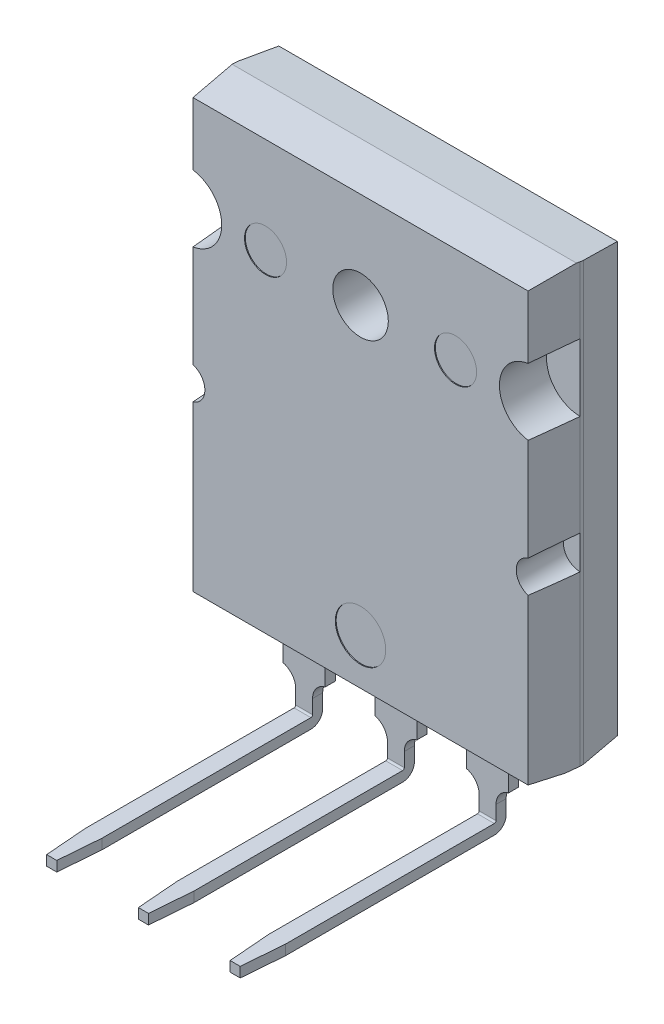
from build123d import *
from OCP.BRepFilletAPI import BRepFilletAPI_MakeChamfer

# Parameters (mm, degrees)
SZKIC1_W                                = 20.5
SZKIC1_H                                = 26
SZKIC1_R                                = 1.65
DODANIE_WYCI_GNI_CIE1_DEPTH             = 5.2
SZKIC2_R                                = 2
SZKIC2_R_2                              = 1
WYTNIJ_WYCI_GNI_CIE1_DEPTH              = 2.8
SZKIC4_W                                = 2.5
SZKIC4_H                                = 0.6
DODANIE_WYCI_GNI_CIE2_DEPTH             = 2.8
SZKIC7_W                                = 1
SZKIC7_H                                = 0.6
DODANIE_WYCI_GNI_CIE3_DEPTH             = 2.5
ZAOKR_GLENIE2_R                         = 1
SFAZOWANIE3_SIZE                        = 2.2
SFAZOWANIE3_SIZE2                       = 0.19247506
SFAZOWANIE4_SIZE                        = 2.8
SFAZOWANIE4_SIZE2                       = 0.294291859
SFAZOWANIE5_SIZE                        = 0.294291859
SFAZOWANIE5_SIZE_2                      = 2.8
SFAZOWANIE6_SIZE                        = 2.2
SFAZOWANIE6_SIZE2                       = 0.270126034
SFAZOWANIE7_SIZE                        = 2
SFAZOWANIE7_SIZE2                       = 0.281081669
SKETCH_1_W                              = 1
SKETCH_1_H                              = 0.6
EXTRUDE_1_DEPTH                         = 15
FILLET_1_R                              = 0.1
FILLET_2_R                              = 0.7
CHAMFER_1_SIZE                          = 2.5
CHAMFER_1_SIZE2                         = 0.2
PATTERN_LINEAR_9_COUNT                  = 2
PATTERN_LINEAR_9_PITCH                  = 5.45
ZAOKR_GLENIE2_OF_PATTERN_LINEAR_9_R     = 1
FILLET_1_OF_PATTERN_LINEAR_9_R          = 0.1
FILLET_2_OF_PATTERN_LINEAR_9_R          = 0.7
CHAMFER_1_OF_PATTERN_LINEAR_9_SIZE      = 2.5
CHAMFER_1_OF_PATTERN_LINEAR_9_SIZE2     = 0.2
PATTERN_LINEAR_9_COL_COUNT              = 2
PATTERN_LINEAR_9_COL_PITCH              = 5.45
ZAOKR_GLENIE2_OF_PATTERN_LINEAR_9_COL_R = 1
FILLET_1_OF_PATTERN_LINEAR_9_COL_R      = 0.1
FILLET_2_OF_PATTERN_LINEAR_9_COL_R      = 0.7
CHAMFER_1_OF_PATTERN_LINEAR_9_COL_SIZE  = 2.5
CHAMFER_1_OF_PATTERN_LINEAR_9_COL_SIZE2 = 0.2
SKETCH_4_R                              = 3.5
EXTRUDE_3_DEPTH                         = 0.0001
SKETCH_5_R                              = 1.249888398
SKETCH_5_R_2                            = 1.497284422
CUT_EXTRUDE_1_DEPTH                     = 0.05


with BuildPart() as part:
    # Szkic1 → Dodanie-wyciągnięcie1 (new body)
    with BuildSketch(Plane.XY):
        with Locations((-13.182644045, 6.74550931)):
            Rectangle(SZKIC1_W, SZKIC1_H)
        with Locations((-13.182644045, 13.74550931)):
            Circle(SZKIC1_R, mode=Mode.SUBTRACT)
    extrude(amount=DODANIE_WYCI_GNI_CIE1_DEPTH)

    # Szkic2 → Wytnij-wyciągnięcie1 (cut)
    with BuildSketch(Plane.XY.offset(5.2)):
        with Locations((-23.432644045, 13.74550931)):
            Circle(SZKIC2_R)
        with Locations((-2.932644045, 13.74550931)):
            Circle(SZKIC2_R)
        with Locations((-23.432644045, 4.74550931)):
            Circle(SZKIC2_R_2)
        with Locations((-2.932644045, 4.74550931)):
            Circle(SZKIC2_R_2)
    extrude(amount=-WYTNIJ_WYCI_GNI_CIE1_DEPTH, mode=Mode.SUBTRACT)

    # Szkic4 → Dodanie-wyciągnięcie2 (add)
    with BuildSketch(Plane.XZ.offset(6.25449069)):
        with Locations((-13.183317029, 2.8)):
            Rectangle(SZKIC4_W, SZKIC4_H)
    dodanie_wyci_gni_cie2 = extrude(amount=DODANIE_WYCI_GNI_CIE2_DEPTH)

    # Szkic7 → Dodanie-wyciągnięcie3 (add)
    with BuildSketch(Plane.XZ.offset(9.05449069)):
        with Locations((-13.183317029, 2.8)):
            Rectangle(SZKIC7_W, SZKIC7_H)
    dodanie_wyci_gni_cie3 = extrude(amount=DODANIE_WYCI_GNI_CIE3_DEPTH)

    # Zaokrąglenie2
    # the kernel refuses this fillet: 1 mm, written as the material it adds along each edge
    with BuildSketch(Plane(origin=(-13.683317029, -9.05449069, 2.5), x_dir=(-1, 0, 0), z_dir=(0, 0, 1)), Plane(origin=(-12.683317029, -9.05449069, 3.1), x_dir=(1, 0, 0), z_dir=(0, 0, -1))) as zaokr_glenie2_piece_1:
        with BuildLine():
            CenterArc((1, 0.968245837), ZAOKR_GLENIE2_R, 180, 75.522487814)
            Line((0, 0.968245837), (-0.02, 0.968245837))
            Line((-0.02, 0.968245837), (-0.02, 0))
            Line((-0.02, 0), (0, -0.02))
            ThreePointArc((0, -0.02), (0.375, -0.02), (0.745, -0.019364917))
            Line((0.745, -0.019364917), (0.75, 0))
        make_face()
    extrude(amount=0.6)

    # Sfazowanie3: one chamfer whose edges measure the first distance from different faces: ONE call of the kernel's chamfer builder (chamfer() names one face for all edges)
    sfazowanie3_edges_1 = [part.edges().sort_by_distance(p)[0] for p in [
        (-2.932644045, 6.74550931, 0),
    ]]
    sfazowanie3_side_1 = [part.faces().sort_by_distance(p)[0] for p in [
        (-2.932644045, 6.177941742, 2.42972973),
    ]]
    sfazowanie3_edges_2 = [part.edges().sort_by_distance(p)[0] for p in [
        (-23.432644045, 6.74550931, 0),
    ]]
    sfazowanie3_side_2 = [part.faces().sort_by_distance(p)[0] for p in [
        (-23.432644045, 6.177941742, 2.42972973),
    ]]
    sfazowanie3 = BRepFilletAPI_MakeChamfer(part.part.solid().wrapped)
    for e in sfazowanie3_edges_1:
        sfazowanie3.Add(SFAZOWANIE3_SIZE, SFAZOWANIE3_SIZE2, e.wrapped, sfazowanie3_side_1[0].wrapped)  # the first distance lies on this face
    for e in sfazowanie3_edges_2:
        sfazowanie3.Add(SFAZOWANIE3_SIZE, SFAZOWANIE3_SIZE2, e.wrapped, sfazowanie3_side_2[0].wrapped)  # the first distance lies on this face
    add(Compound.cast(sfazowanie3.Shape()), mode=Mode.REPLACE)

    # Sfazowanie4: one chamfer whose edges measure the first distance from different faces: ONE call of the kernel's chamfer builder (chamfer() names one face for all edges)
    sfazowanie4_edges_1 = [part.edges().sort_by_distance(p)[0] for p in [
        (-2.932644045, -1.25449069, 5.2),
        (-2.932644045, 8.74550931, 5.2),
        (-2.932644045, 17.74550931, 5.2),
    ]]
    sfazowanie4_side_1 = [part.faces().sort_by_distance(p)[0] for p in [
        (-2.932644045, -5.992765643, 3.7),
    ]]
    sfazowanie4_edges_2 = [part.edges().sort_by_distance(p)[0] for p in [
        (-23.432644045, 17.74550931, 5.2),
        (-23.432644045, -1.25449069, 5.2),
        (-23.432644045, 8.74550931, 5.2),
    ]]
    sfazowanie4_side_2 = [part.faces().sort_by_distance(p)[0] for p in [
        (-23.432644045, 19.483784263, 3.7),
    ]]
    sfazowanie4 = BRepFilletAPI_MakeChamfer(part.part.solid().wrapped)
    for e in sfazowanie4_edges_1:
        sfazowanie4.Add(SFAZOWANIE4_SIZE, SFAZOWANIE4_SIZE2, e.wrapped, sfazowanie4_side_1[0].wrapped)  # the first distance lies on this face
    for e in sfazowanie4_edges_2:
        sfazowanie4.Add(SFAZOWANIE4_SIZE, SFAZOWANIE4_SIZE2, e.wrapped, sfazowanie4_side_2[0].wrapped)  # the first distance lies on this face
    add(Compound.cast(sfazowanie4.Shape()), mode=Mode.REPLACE)

    # Sfazowanie5
    # the kernel refuses this chamfer: 2.8, 0.294291859 mm, written as the material it takes off along each edge
    with BuildSketch(Plane(origin=(-30.518693961, 19.74550931, 0), x_dir=(0, -0.9396808679591201, -0.3420524322258136), z_dir=(1, 0, 0))) as sfazowanie5_piece_1:
        Polygon((SFAZOWANIE5_SIZE * 0.939680867141, -SFAZOWANIE5_SIZE * 0.342052431928), (-SFAZOWANIE5_SIZE_2 * 0.342052432226, -SFAZOWANIE5_SIZE_2 * 0.939680867959), (0, 0), align=None)
    extrude(amount=34.672099833, mode=Mode.SUBTRACT)
    with BuildSketch(Plane(origin=(-30.416877162, 19.74550931, 5.2), x_dir=(0, -0.9396808679591199, 0.34205243222581383), z_dir=(1, 0, 0))) as sfazowanie5_piece_2:
        Polygon((SFAZOWANIE5_SIZE * 0.939680867141, SFAZOWANIE5_SIZE * 0.342052431928), (-SFAZOWANIE5_SIZE_2 * 0.342052432226, SFAZOWANIE5_SIZE_2 * 0.939680867959), (0, 0), align=None)
    extrude(amount=34.468466235, mode=Mode.SUBTRACT)

    # Sfazowanie6
    sfazowanie6_edges = [part.edges().sort_by_distance(p)[0] for p in [
        (-13.182644045, -6.25449069, 0),
    ]]
    sfazowanie6_side = [part.faces().sort_by_distance(p)[0] for p in [
        (-3.144136362, -6.25449069, 2.3),
    ]]
    chamfer(sfazowanie6_edges, length=SFAZOWANIE6_SIZE, length2=SFAZOWANIE6_SIZE2, reference=sfazowanie6_side[0])

    # Sfazowanie7
    sfazowanie7_edges = [part.edges().sort_by_distance(p)[0] for p in [
        (-13.182644045, -6.25449069, 5.2),
    ]]
    sfazowanie7_side = [part.faces().sort_by_distance(p)[0] for p in [
        (-13.182626986, -6.25449069, 3.714922556),
    ]]
    chamfer(sfazowanie7_edges, length=SFAZOWANIE7_SIZE, length2=SFAZOWANIE7_SIZE2, reference=sfazowanie7_side[0])

    # 草图1 → 凸台-拉伸1 (add)
    with BuildSketch(Plane.XY.offset(3.1)):
        with Locations((-13.183317029, -11.25449069)):
            Rectangle(SKETCH_1_W, SKETCH_1_H)
    extrude_1 = extrude(amount=EXTRUDE_1_DEPTH)

    # 圆角1
    fillet_1_edges = [part.edges().sort_by_distance(p)[0] for p in [
        (-13.183317029, -10.95449069, 3.1),
    ]]
    fillet(fillet_1_edges, radius=FILLET_1_R)

    # 圆角2
    fillet_2_edges = [part.edges().sort_by_distance(p)[0] for p in [
        (-13.183317029, -11.55449069, 2.5),
    ]]
    fillet(fillet_2_edges, radius=FILLET_2_R)

    # 倒角1: one chamfer whose edges measure the first distance from different faces: ONE call of the kernel's chamfer builder (chamfer() names one face for all edges)
    chamfer_1_edges_1 = [part.edges().sort_by_distance(p)[0] for p in [
        (-13.683317029, -11.25449069, 18.1),
    ]]
    chamfer_1_side_1 = [part.faces().sort_by_distance(p)[0] for p in [
        (-13.683317029, -11.209262494, 9.953166713),
    ]]
    chamfer_1_edges_2 = [part.edges().sort_by_distance(p)[0] for p in [
        (-12.683317029, -11.25449069, 18.1),
    ]]
    chamfer_1_side_2 = [part.faces().sort_by_distance(p)[0] for p in [
        (-12.683317029, -11.209262494, 9.953166713),
    ]]
    chamfer_1 = BRepFilletAPI_MakeChamfer(part.part.solid().wrapped)
    for e in chamfer_1_edges_1:
        chamfer_1.Add(CHAMFER_1_SIZE, CHAMFER_1_SIZE2, e.wrapped, chamfer_1_side_1[0].wrapped)  # the first distance lies on this face
    for e in chamfer_1_edges_2:
        chamfer_1.Add(CHAMFER_1_SIZE, CHAMFER_1_SIZE2, e.wrapped, chamfer_1_side_2[0].wrapped)  # the first distance lies on this face
    add(Compound.cast(chamfer_1.Shape()), mode=Mode.REPLACE)

    # 阵列(线性)9: Dodanie-wyciągnięcie2, Dodanie-wyciągnięcie3, 凸台-拉伸1 ×2
    with Locations(*[(i * PATTERN_LINEAR_9_PITCH, 0, 0) for i in range(1, PATTERN_LINEAR_9_COUNT)]):
        add(dodanie_wyci_gni_cie2)
        add(dodanie_wyci_gni_cie3)
        add(extrude_1)

    # Zaokrąglenie2 of 阵列(线性)9
    # the kernel refuses this fillet: 1 mm, written as the material it adds along each edge
    with BuildSketch(Plane(origin=(-8.233317029, -9.05449069, 2.5), x_dir=(-1, 0, 0), z_dir=(0, 0, 1))) as zaokr_glenie2_of_pattern_linear_9_piece_1:
        with BuildLine():
            CenterArc((1, 0.968245837), ZAOKR_GLENIE2_OF_PATTERN_LINEAR_9_R, 180, 75.522487814)
            Line((0, 0.968245837), (-0.02, 0.968245837))
            Line((-0.02, 0.968245837), (-0.02, 0))
            Line((-0.02, 0), (0, -0.02))
            ThreePointArc((0, -0.02), (0.375, -0.02), (0.745, -0.019364917))
            Line((0.745, -0.019364917), (0.75, 0))
        make_face()
    extrude(amount=0.6)
    with BuildSketch(Plane(origin=(-7.233317029, -9.05449069, 3.1), x_dir=(0, -1, 0), z_dir=(0, 0, -1))) as zaokr_glenie2_of_pattern_linear_9_piece_2:
        with BuildLine():
            CenterArc((0.968245837, -1), ZAOKR_GLENIE2_OF_PATTERN_LINEAR_9_R, 90, 75.522487814)
            Line((0, -0.75), (-0.019364917, -0.745))
            ThreePointArc((-0.019364917, -0.745), (-0.02, -0.375), (-0.02, 0))
            Line((-0.02, 0), (0, 0.02))
            Line((0, 0.02), (0.968245837, 0.02))
            Line((0.968245837, 0.02), (0.968245837, 0))
        make_face()
    extrude(amount=0.6)

    # 圆角1 of 阵列(线性)9
    fillet_1_of_pattern_linear_9_edges = [part.edges().sort_by_distance(p)[0] for p in [
        (-7.733317029, -10.95449069, 3.1),
    ]]
    fillet(fillet_1_of_pattern_linear_9_edges, radius=FILLET_1_OF_PATTERN_LINEAR_9_R)

    # 圆角2 of 阵列(线性)9
    fillet_2_of_pattern_linear_9_edges = [part.edges().sort_by_distance(p)[0] for p in [
        (-7.733317029, -11.55449069, 2.5),
    ]]
    fillet(fillet_2_of_pattern_linear_9_edges, radius=FILLET_2_OF_PATTERN_LINEAR_9_R)

    # 倒角1 of 阵列(线性)9: one chamfer whose edges measure the first distance from different faces: ONE call of the kernel's chamfer builder (chamfer() names one face for all edges)
    chamfer_1_of_pattern_linear_9_edges_1 = [part.edges().sort_by_distance(p)[0] for p in [
        (-8.233317029, -11.25449069, 18.1),
    ]]
    chamfer_1_of_pattern_linear_9_side_1 = [part.faces().sort_by_distance(p)[0] for p in [
        (-8.233317029, -11.209262494, 9.953166713),
    ]]
    chamfer_1_of_pattern_linear_9_edges_2 = [part.edges().sort_by_distance(p)[0] for p in [
        (-7.233317029, -11.25449069, 18.1),
    ]]
    chamfer_1_of_pattern_linear_9_side_2 = [part.faces().sort_by_distance(p)[0] for p in [
        (-7.233317029, -11.209262494, 9.953166713),
    ]]
    chamfer_1_of_pattern_linear_9 = BRepFilletAPI_MakeChamfer(part.part.solid().wrapped)
    for e in chamfer_1_of_pattern_linear_9_edges_1:
        chamfer_1_of_pattern_linear_9.Add(CHAMFER_1_OF_PATTERN_LINEAR_9_SIZE, CHAMFER_1_OF_PATTERN_LINEAR_9_SIZE2, e.wrapped, chamfer_1_of_pattern_linear_9_side_1[0].wrapped)  # the first distance lies on this face
    for e in chamfer_1_of_pattern_linear_9_edges_2:
        chamfer_1_of_pattern_linear_9.Add(CHAMFER_1_OF_PATTERN_LINEAR_9_SIZE, CHAMFER_1_OF_PATTERN_LINEAR_9_SIZE2, e.wrapped, chamfer_1_of_pattern_linear_9_side_2[0].wrapped)  # the first distance lies on this face
    add(Compound.cast(chamfer_1_of_pattern_linear_9.Shape()), mode=Mode.REPLACE)

    # 阵列(线性)9 col: Dodanie-wyciągnięcie2, Dodanie-wyciągnięcie3, 凸台-拉伸1 ×2
    with Locations(*[(-i * PATTERN_LINEAR_9_COL_PITCH, 0, 0) for i in range(1, PATTERN_LINEAR_9_COL_COUNT)]):
        add(dodanie_wyci_gni_cie2)
        add(dodanie_wyci_gni_cie3)
        add(extrude_1)

    # Zaokrąglenie2 of 阵列(线性)9 col
    # the kernel refuses this fillet: 1 mm, written as the material it adds along each edge
    with BuildSketch(Plane(origin=(-19.133317029, -9.05449069, 2.5), x_dir=(-1, 0, 0), z_dir=(0, 0, 1))) as zaokr_glenie2_of_pattern_linear_9_col_piece_1:
        with BuildLine():
            CenterArc((1, 0.968245837), ZAOKR_GLENIE2_OF_PATTERN_LINEAR_9_COL_R, 180, 75.522487814)
            Line((0, 0.968245837), (-0.02, 0.968245837))
            Line((-0.02, 0.968245837), (-0.02, 0))
            Line((-0.02, 0), (0, -0.02))
            ThreePointArc((0, -0.02), (0.375, -0.02), (0.745, -0.019364917))
            Line((0.745, -0.019364917), (0.75, 0))
        make_face()
    extrude(amount=0.6)
    with BuildSketch(Plane(origin=(-18.133317029, -9.05449069, 3.1), x_dir=(0, -1, 0), z_dir=(0, 0, -1))) as zaokr_glenie2_of_pattern_linear_9_col_piece_2:
        with BuildLine():
            CenterArc((0.968245837, -1), ZAOKR_GLENIE2_OF_PATTERN_LINEAR_9_COL_R, 90, 75.522487814)
            Line((0, -0.75), (-0.019364917, -0.745))
            ThreePointArc((-0.019364917, -0.745), (-0.02, -0.375), (-0.02, 0))
            Line((-0.02, 0), (0, 0.02))
            Line((0, 0.02), (0.968245837, 0.02))
            Line((0.968245837, 0.02), (0.968245837, 0))
        make_face()
    extrude(amount=0.6)

    # 圆角1 of 阵列(线性)9 col
    fillet_1_of_pattern_linear_9_col_edges = [part.edges().sort_by_distance(p)[0] for p in [
        (-18.633317029, -10.95449069, 3.1),
    ]]
    fillet(fillet_1_of_pattern_linear_9_col_edges, radius=FILLET_1_OF_PATTERN_LINEAR_9_COL_R)

    # 圆角2 of 阵列(线性)9 col
    fillet_2_of_pattern_linear_9_col_edges = [part.edges().sort_by_distance(p)[0] for p in [
        (-18.633317029, -11.55449069, 2.5),
    ]]
    fillet(fillet_2_of_pattern_linear_9_col_edges, radius=FILLET_2_OF_PATTERN_LINEAR_9_COL_R)

    # 倒角1 of 阵列(线性)9 col: one chamfer whose edges measure the first distance from different faces: ONE call of the kernel's chamfer builder (chamfer() names one face for all edges)
    chamfer_1_of_pattern_linear_9_col_edges_1 = [part.edges().sort_by_distance(p)[0] for p in [
        (-19.133317029, -11.25449069, 18.1),
    ]]
    chamfer_1_of_pattern_linear_9_col_side_1 = [part.faces().sort_by_distance(p)[0] for p in [
        (-19.133317029, -11.209262494, 9.953166713),
    ]]
    chamfer_1_of_pattern_linear_9_col_edges_2 = [part.edges().sort_by_distance(p)[0] for p in [
        (-18.133317029, -11.25449069, 18.1),
    ]]
    chamfer_1_of_pattern_linear_9_col_side_2 = [part.faces().sort_by_distance(p)[0] for p in [
        (-18.133317029, -11.209262494, 9.953166713),
    ]]
    chamfer_1_of_pattern_linear_9_col = BRepFilletAPI_MakeChamfer(part.part.solid().wrapped)
    for e in chamfer_1_of_pattern_linear_9_col_edges_1:
        chamfer_1_of_pattern_linear_9_col.Add(CHAMFER_1_OF_PATTERN_LINEAR_9_COL_SIZE, CHAMFER_1_OF_PATTERN_LINEAR_9_COL_SIZE2, e.wrapped, chamfer_1_of_pattern_linear_9_col_side_1[0].wrapped)  # the first distance lies on this face
    for e in chamfer_1_of_pattern_linear_9_col_edges_2:
        chamfer_1_of_pattern_linear_9_col.Add(CHAMFER_1_OF_PATTERN_LINEAR_9_COL_SIZE, CHAMFER_1_OF_PATTERN_LINEAR_9_COL_SIZE2, e.wrapped, chamfer_1_of_pattern_linear_9_col_side_2[0].wrapped)  # the first distance lies on this face
    add(Compound.cast(chamfer_1_of_pattern_linear_9_col.Shape()), mode=Mode.REPLACE)

    # 草图4 → 凸台-拉伸3 (add)
    with BuildSketch(Plane(origin=(0, 0, 0), x_dir=(-1, 0, 0), z_dir=(0, 0, -1))):
        with BuildLine():
            Line((5.750210339, 17.951217451), (4.125119105, 16.326126217))
            Line((4.125119105, 16.326126217), (4.125119105, 15.168616255))
            ThreePointArc((4.125119105, 15.168616255), (5.067970026, 13.74550931), (4.125119105, 12.322402365))
            Line((4.125119105, 12.322402365), (4.125119105, -1.345944481))
            Line((4.125119105, -1.345944481), (4.26353928, -1.484364656))
            Line((4.26353928, -1.484364656), (22.10174881, -1.484364656))
            Line((22.10174881, -1.484364656), (22.240168985, -1.345944481))
            Line((22.240168985, -1.345944481), (22.240168985, 12.322402365))
            ThreePointArc((22.240168985, 12.322402365), (21.297318064, 13.74550931), (22.240168985, 15.168616255))
            Line((22.240168985, 15.168616255), (22.240168985, 16.326126217))
            Line((22.240168985, 16.326126217), (20.615077751, 17.951217451))
            Line((20.615077751, 17.951217451), (5.750210339, 17.951217451))
        make_face()
        with Locations((13.182644045, 13.74550931)):
            Circle(SKETCH_4_R, mode=Mode.SUBTRACT)
    extrude(amount=EXTRUDE_3_DEPTH)

    # 草图5 → 切除-拉伸1 (cut)
    with BuildSketch(Plane.XY.offset(5.2)):
        with Locations(Location((-7.537050492, 13.74550931, 0), (0, 0, 180))):
            Circle(SKETCH_5_R)
        with Locations((-18.828237598, 13.74550931)):
            Circle(SKETCH_5_R)
        with Locations((-13.182644045, -3.245598745)):
            Circle(SKETCH_5_R_2)
    extrude(amount=-CUT_EXTRUDE_1_DEPTH, mode=Mode.SUBTRACT)


solid = part.part
